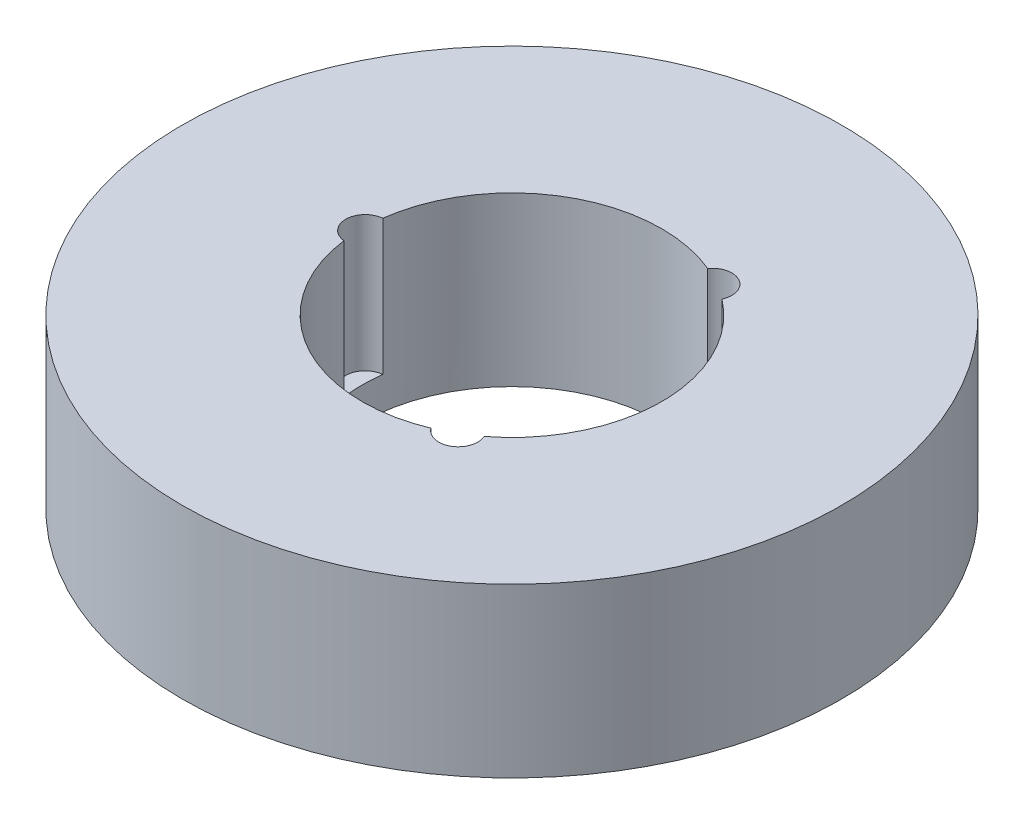
from build123d import *

# Parameters (mm, degrees)
SKETCH1_R           = 55
BOSS_EXTRUDE1_DEPTH = 28
SKETCH2_R           = 25
CUT_EXTRUDE1_DEPTH  = 83.668010742
SKETCH3_R           = 3.255684797
CUT_EXTRUDE2_DEPTH  = 22.580864179
CIRPATTERN1_COUNT   = 3


with BuildPart() as part:
    # Sketch1 → Boss-Extrude1 (new body)
    with BuildSketch(Plane(origin=(0, 0, 0), x_dir=(1, 0, 0), z_dir=(0, 1, 0))):
        Circle(SKETCH1_R)
    extrude(amount=BOSS_EXTRUDE1_DEPTH)

    # Sketch2 → Cut-Extrude1 (cut, through all)
    with BuildSketch(Plane(origin=(0, 0, 0), x_dir=(1, 0, 0), z_dir=(0, 1, 0))):
        Circle(SKETCH2_R)
    extrude(amount=CUT_EXTRUDE1_DEPTH, mode=Mode.SUBTRACT)

    # Sketch3 → Cut-Extrude2 (cut)
    with BuildSketch(Plane(origin=(0, 28, 0), x_dir=(1, 0, 0), z_dir=(0, 1, 0))):
        with Locations((-24.482681983, 0)):
            Circle(SKETCH3_R)
    cut_extrude2 = extrude(amount=-CUT_EXTRUDE2_DEPTH, mode=Mode.SUBTRACT)

    # CirPattern1: Cut-Extrude2 ×3 about axis
    cirpattern1_axis = Axis((0, 0, 0), (0, 1, 0))
    for i in range(1, CIRPATTERN1_COUNT):
        add(cut_extrude2.rotate(cirpattern1_axis, i * 360 / CIRPATTERN1_COUNT), mode=Mode.SUBTRACT)


solid = part.part
